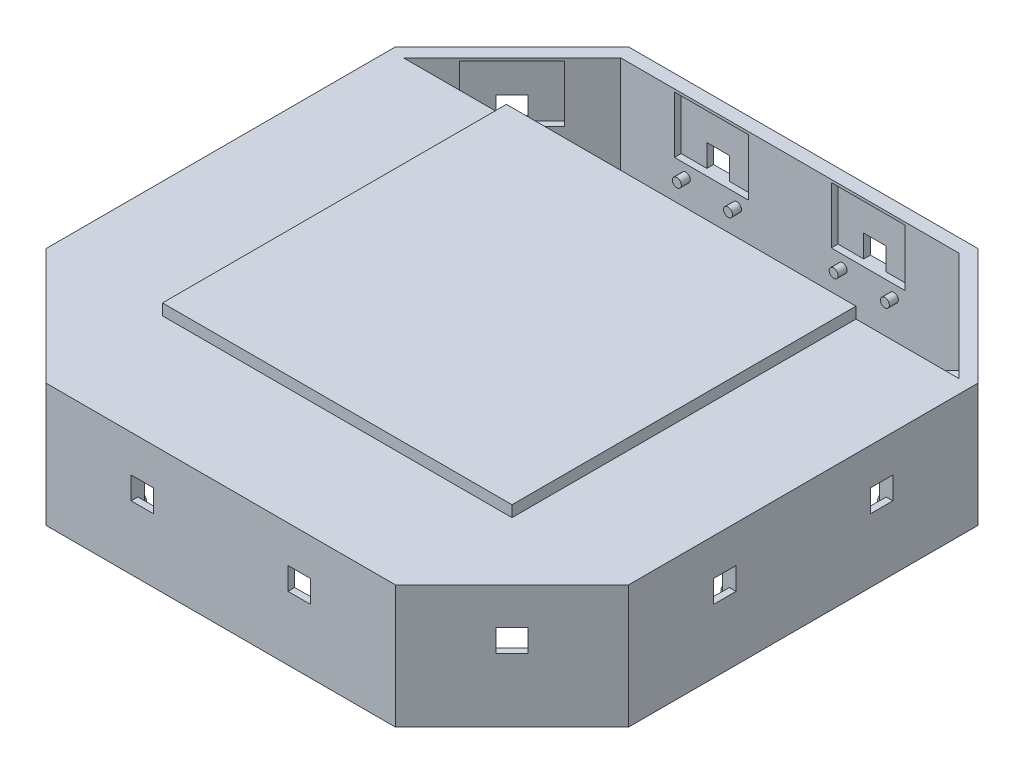
from build123d import *

# Parameters (mm, degrees)
SKETCH1_W            = 78
SKETCH1_H            = 78
BOSS_EXTRUDE1_DEPTH  = 2.5
SKETCH4_W            = 130
SKETCH4_H            = 130
BOSS_EXTRUDE2_DEPTH  = 2.5
CHAMFER1_SIZE        = 26
BOSS_EXTRUDE3_DEPTH  = 25
CUT_EXTRUDE3_REACH   = 147.294
SKETCH6_W            = 5
SKETCH6_H            = 5
CUT_EXTRUDE6_REACH   = 166.774
SKETCH13_W           = 5
SKETCH13_H           = 5
SKETCH9_W            = 12.65
SKETCH9_H            = 16.5
CUT_EXTRUDE5_DEPTH   = 1.5
SKETCH14_W           = 12.65
SKETCH14_H           = 16.5
CUT_EXTRUDE7_DEPTH   = 1.5
SKETCH10_R           = 1
SKETCH10_W           = 2
SKETCH10_H           = 16.5
BOSS_EXTRUDE5_DEPTH  = 2
SKETCH15_R           = 1
SKETCH15_W           = 2
SKETCH15_H           = 16.5
BOSS_EXTRUDE9_DEPTH  = 2
CUT_EXTRUDE8_REACH   = 147.294
SKETCH16_W           = 5
SKETCH16_H           = 5
SKETCH17_W           = 12.65
SKETCH17_H           = 16.5
CUT_EXTRUDE9_DEPTH   = 1.5
SKETCH18_R           = 1
SKETCH18_W           = 2
SKETCH18_H           = 16.5
BOSS_EXTRUDE10_DEPTH = 2
CUT_EXTRUDE10_REACH  = 166.774
SKETCH19_W           = 5
SKETCH19_H           = 5
SKETCH20_W           = 12.65
SKETCH20_H           = 16.5
CUT_EXTRUDE11_DEPTH  = 1.5
SKETCH21_R           = 1
SKETCH21_W           = 2
SKETCH21_H           = 16.5
BOSS_EXTRUDE11_DEPTH = 2
CUT_EXTRUDE12_REACH  = 147.294
SKETCH22_W           = 5
SKETCH22_H           = 5
SKETCH23_W           = 12.65
SKETCH23_H           = 16.5
CUT_EXTRUDE13_DEPTH  = 1.5
BOSS_EXTRUDE12_START = 2
SKETCH24_R           = 1
SKETCH24_W           = 2
SKETCH24_H           = 16.5
BOSS_EXTRUDE12_DEPTH = 2
CUT_EXTRUDE16_REACH  = 97.263
CUT_EXTRUDE17_REACH  = 166.774
SKETCH28_W           = 5
SKETCH28_H           = 5
SKETCH29_W           = 16.5
SKETCH29_H           = 12.65
CUT_EXTRUDE18_DEPTH  = 1.5
SKETCH30_R           = 1
BOSS_EXTRUDE13_DEPTH = 2
CUT_EXTRUDE20_REACH  = 147.294
SKETCH32_W           = 5
SKETCH32_H           = 5
SKETCH33_W           = 16.5
SKETCH33_H           = 12.65
CUT_EXTRUDE21_DEPTH  = 1.5
SKETCH34_R           = 1
BOSS_EXTRUDE14_DEPTH = 2
CUT_EXTRUDE22_REACH  = 166.774
SKETCH35_W           = 5
SKETCH35_H           = 5
SKETCH36_W           = 16.5
SKETCH36_H           = 12.65
CUT_EXTRUDE23_DEPTH  = 1.5
SKETCH37_R           = 1
BOSS_EXTRUDE15_DEPTH = 2


with BuildPart() as part:
    # Sketch1 → Boss-Extrude1 (new body)
    with BuildSketch(Plane(origin=(0, 0, 0), x_dir=(1, 0, 0), z_dir=(0, 1, 0))):
        Rectangle(SKETCH1_W, SKETCH1_H)
    extrude(amount=BOSS_EXTRUDE1_DEPTH)

    # Sketch4 → Boss-Extrude2 (add)
    with BuildSketch(Plane(origin=(0, 0, 0), x_dir=(-1, 0, 0), z_dir=(0, -1, 0))):
        Rectangle(SKETCH4_W, SKETCH4_H)
    extrude(amount=BOSS_EXTRUDE2_DEPTH)

    # Chamfer1
    chamfer1_edges = [part.edges().sort_by_distance(p)[0] for p in [
        (65, -1.25, 65),
        (-65, -1.25, 65),
        (-65, -1.25, -65),
        (65, -1.25, -65),
    ]]
    chamfer(chamfer1_edges, length=CHAMFER1_SIZE)

    # Sketch5 → Boss-Extrude3 (add)
    with BuildSketch(Plane(origin=(0, -2.5, 0), x_dir=(-1, 0, 0), z_dir=(0, -1, 0))):
        Polygon((39, 65), (-39, 65), (-65, 39), (-65, -39), (-39, -65), (39, -65), (65, -39), (65, 39), align=None)
        Polygon((37.757359313, 62), (-37.757359313, 62), (-62, 37.757359313), (-62, -37.757359313), (-37.757359313, -62), (37.757359313, -62), (62, -37.757359313), (62, 37.757359313), align=None, mode=Mode.SUBTRACT)
    extrude(amount=BOSS_EXTRUDE3_DEPTH)

    # Sketch6 → Cut-Extrude3 (cut, up to next)
    with BuildSketch(Plane(origin=(0, 0, 62), x_dir=(-1, 0, 0), z_dir=(0, 0, -1)), mode=Mode.PRIVATE) as cut_extrude3_sk1:
        with Locations((-17.5, -10.75)):
            Rectangle(SKETCH6_W, SKETCH6_H)
    cut_extrude3_tool1 = extrude(cut_extrude3_sk1.sketch, amount=-CUT_EXTRUDE3_REACH, mode=Mode.PRIVATE) & part.part
    # Sketch6 → Cut-Extrude3 (cut, up to next)
    with BuildSketch(Plane(origin=(0, 0, 62), x_dir=(-1, 0, 0), z_dir=(0, 0, -1)), mode=Mode.PRIVATE) as cut_extrude3_sk2:
        with Locations((17.5, -10.75)):
            Rectangle(SKETCH6_W, SKETCH6_H)
    cut_extrude3_tool2 = extrude(cut_extrude3_sk2.sketch, amount=-CUT_EXTRUDE3_REACH, mode=Mode.PRIVATE) & part.part
    add(cut_extrude3_tool1.solids().sort_by_distance((17.5, -10.75, 62))[0], mode=Mode.SUBTRACT)
    add(cut_extrude3_tool2.solids().sort_by_distance((-17.5, -10.75, 62))[0], mode=Mode.SUBTRACT)

    # Sketch13 → Cut-Extrude6 (cut, up to next)
    with BuildSketch(Plane(origin=(-49.878679656, 0, 49.878679656), x_dir=(-0.7071067811865495, 0, -0.7071067811865457), z_dir=(0.7071067811865457, 0, -0.7071067811865495)), mode=Mode.PRIVATE) as cut_extrude6_sk1:
        with Locations((0, -10.75)):
            Rectangle(SKETCH13_W, SKETCH13_H)
    cut_extrude6_tool1 = extrude(cut_extrude6_sk1.sketch, amount=-CUT_EXTRUDE6_REACH, mode=Mode.PRIVATE) & part.part
    add(cut_extrude6_tool1.solids().sort_by_distance((-49.87868, -10.75, 49.87868))[0], mode=Mode.SUBTRACT)

    # Sketch9 → Cut-Extrude5 (cut)
    with BuildSketch(Plane(origin=(0, 0, 62), x_dir=(-1, 0, 0), z_dir=(0, 0, -1))):
        with Locations((13.675, -10.75)):
            Rectangle(SKETCH9_W, SKETCH9_H)
        with Locations((-13.675, -10.75)):
            Rectangle(SKETCH9_W, SKETCH9_H)
    extrude(amount=-CUT_EXTRUDE5_DEPTH, mode=Mode.SUBTRACT)

    # Sketch14 → Cut-Extrude7 (cut)
    with BuildSketch(Plane(origin=(-49.878679656, 0, 49.878679656), x_dir=(-0.7071067811865495, 0, -0.7071067811865457), z_dir=(0.7071067811865457, 0, -0.7071067811865495))):
        with Locations((-3.825, -10.75)):
            Rectangle(SKETCH14_W, SKETCH14_H)
    extrude(amount=-CUT_EXTRUDE7_DEPTH, mode=Mode.SUBTRACT)

    # Sketch10 → Boss-Extrude5 (add)
    with BuildSketch(Plane(origin=(0, 0, 62), x_dir=(-1, 0, 0), z_dir=(0, 0, -1))):
        with Locations((22.59, -16.469)):
            Circle(SKETCH10_R)
        with Locations((22.59, -5.039)):
            Circle(SKETCH10_R)
        with Locations((-22.59, -16.469)):
            Circle(SKETCH10_R)
        with Locations((-22.59, -5.039)):
            Circle(SKETCH10_R)
        with Locations((6.35, -10.75)):
            Rectangle(SKETCH10_W, SKETCH10_H)
        with Locations((-6.35, -10.75)):
            Rectangle(SKETCH10_W, SKETCH10_H)
    extrude(amount=BOSS_EXTRUDE5_DEPTH)

    # Sketch15 → Boss-Extrude9 (add)
    with BuildSketch(Plane(origin=(-49.878679656, 0, 49.878679656), x_dir=(-0.7071067811865495, 0, -0.7071067811865457), z_dir=(0.7071067811865457, 0, -0.7071067811865495))):
        with Locations((5.09, -16.465)):
            Circle(SKETCH15_R)
        with Locations((5.09, -5.035)):
            Circle(SKETCH15_R)
        with Locations((-11.15, -10.75)):
            Rectangle(SKETCH15_W, SKETCH15_H)
    extrude(amount=BOSS_EXTRUDE9_DEPTH)

    # Sketch16 → Cut-Extrude8 (cut, up to next)
    with BuildSketch(Plane(origin=(-62, 0, 0), x_dir=(0, 0, -1), z_dir=(1, 0, 0)), mode=Mode.PRIVATE) as cut_extrude8_sk1:
        with Locations((17.5, -10.75)):
            Rectangle(SKETCH16_W, SKETCH16_H)
    cut_extrude8_tool1 = extrude(cut_extrude8_sk1.sketch, amount=-CUT_EXTRUDE8_REACH, mode=Mode.PRIVATE) & part.part
    # Sketch16 → Cut-Extrude8 (cut, up to next)
    with BuildSketch(Plane(origin=(-62, 0, 0), x_dir=(0, 0, -1), z_dir=(1, 0, 0)), mode=Mode.PRIVATE) as cut_extrude8_sk2:
        with Locations((-17.5, -10.75)):
            Rectangle(SKETCH16_W, SKETCH16_H)
    cut_extrude8_tool2 = extrude(cut_extrude8_sk2.sketch, amount=-CUT_EXTRUDE8_REACH, mode=Mode.PRIVATE) & part.part
    add(cut_extrude8_tool1.solids().sort_by_distance((-62, -10.75, -17.5))[0], mode=Mode.SUBTRACT)
    add(cut_extrude8_tool2.solids().sort_by_distance((-62, -10.75, 17.5))[0], mode=Mode.SUBTRACT)

    # Sketch17 → Cut-Extrude9 (cut)
    with BuildSketch(Plane(origin=(-62, 0, 0), x_dir=(0, 0, -1), z_dir=(1, 0, 0))):
        with Locations((-21.325, -10.75)):
            Rectangle(SKETCH17_W, SKETCH17_H)
        with Locations((13.675, -10.75)):
            Rectangle(SKETCH17_W, SKETCH17_H)
    extrude(amount=-CUT_EXTRUDE9_DEPTH, mode=Mode.SUBTRACT)

    # Sketch18 → Boss-Extrude10 (add)
    with BuildSketch(Plane(origin=(-62, 0, 0), x_dir=(0, 0, -1), z_dir=(1, 0, 0))):
        with Locations((22.59, -16.465)):
            Circle(SKETCH18_R)
        with Locations((22.59, -5.035)):
            Circle(SKETCH18_R)
        with Locations((-12.41, -16.465)):
            Circle(SKETCH18_R)
        with Locations((-12.41, -5.035)):
            Circle(SKETCH18_R)
        with Locations((6.35, -10.75)):
            Rectangle(SKETCH18_W, SKETCH18_H)
        with Locations((-28.65, -10.75)):
            Rectangle(SKETCH18_W, SKETCH18_H)
    extrude(amount=BOSS_EXTRUDE10_DEPTH)

    # Sketch19 → Cut-Extrude10 (cut, up to next)
    with BuildSketch(Plane(origin=(49.878679656, 0, 49.878679656), x_dir=(-0.707106781186546, 0, 0.707106781186549), z_dir=(-0.707106781186549, 0, -0.707106781186546)), mode=Mode.PRIVATE) as cut_extrude10_sk1:
        with Locations((0, -10.75)):
            Rectangle(SKETCH19_W, SKETCH19_H)
    cut_extrude10_tool1 = extrude(cut_extrude10_sk1.sketch, amount=-CUT_EXTRUDE10_REACH, mode=Mode.PRIVATE) & part.part
    add(cut_extrude10_tool1.solids().sort_by_distance((49.87868, -10.75, 49.87868))[0], mode=Mode.SUBTRACT)

    # Sketch20 → Cut-Extrude11 (cut)
    with BuildSketch(Plane(origin=(49.878679656, 0, 49.878679656), x_dir=(-0.707106781186546, 0, 0.707106781186549), z_dir=(-0.707106781186549, 0, -0.707106781186546))):
        with Locations((3.825, -10.75)):
            Rectangle(SKETCH20_W, SKETCH20_H)
    extrude(amount=-CUT_EXTRUDE11_DEPTH, mode=Mode.SUBTRACT)

    # Sketch21 → Boss-Extrude11 (add)
    with BuildSketch(Plane(origin=(49.878679656, 0, 49.878679656), x_dir=(-0.707106781186546, 0, 0.707106781186549), z_dir=(-0.707106781186549, 0, -0.707106781186546))):
        with Locations((-5.09, -16.465)):
            Circle(SKETCH21_R)
        with Locations((-5.09, -5.035)):
            Circle(SKETCH21_R)
        with Locations((11.15, -10.75)):
            Rectangle(SKETCH21_W, SKETCH21_H)
    extrude(amount=BOSS_EXTRUDE11_DEPTH)

    # Sketch22 → Cut-Extrude12 (cut, up to next)
    with BuildSketch(Plane.ZY.offset(-62), mode=Mode.PRIVATE) as cut_extrude12_sk1:
        with Locations((17.5, -10.75)):
            Rectangle(SKETCH22_W, SKETCH22_H)
    cut_extrude12_tool1 = extrude(cut_extrude12_sk1.sketch, amount=-CUT_EXTRUDE12_REACH, mode=Mode.PRIVATE) & part.part
    # Sketch22 → Cut-Extrude12 (cut, up to next)
    with BuildSketch(Plane.ZY.offset(-62), mode=Mode.PRIVATE) as cut_extrude12_sk2:
        with Locations((-17.5, -10.75)):
            Rectangle(SKETCH22_W, SKETCH22_H)
    cut_extrude12_tool2 = extrude(cut_extrude12_sk2.sketch, amount=-CUT_EXTRUDE12_REACH, mode=Mode.PRIVATE) & part.part
    add(cut_extrude12_tool1.solids().sort_by_distance((62, -10.75, 17.5))[0], mode=Mode.SUBTRACT)
    add(cut_extrude12_tool2.solids().sort_by_distance((62, -10.75, -17.5))[0], mode=Mode.SUBTRACT)

    # Sketch23 → Cut-Extrude13 (cut)
    with BuildSketch(Plane.ZY.offset(-62)):
        with Locations((21.325, -10.75)):
            Rectangle(SKETCH23_W, SKETCH23_H)
        with Locations((-13.675, -10.75)):
            Rectangle(SKETCH23_W, SKETCH23_H)
    extrude(amount=-CUT_EXTRUDE13_DEPTH, mode=Mode.SUBTRACT)

    # Sketch24 → Boss-Extrude12 (add)
    with BuildSketch(Plane.ZY.offset(-62).offset(BOSS_EXTRUDE12_START)):
        with Locations((12.41, -16.465)):
            Circle(SKETCH24_R)
        with Locations((12.41, -5.035)):
            Circle(SKETCH24_R)
        with Locations((-22.59, -16.465)):
            Circle(SKETCH24_R)
        with Locations((-22.59, -5.035)):
            Circle(SKETCH24_R)
        with Locations((28.65, -10.75)):
            Rectangle(SKETCH24_W, SKETCH24_H)
        with Locations((-6.35, -10.75)):
            Rectangle(SKETCH24_W, SKETCH24_H)
    extrude(amount=-BOSS_EXTRUDE12_DEPTH)

    # Sketch27 → Cut-Extrude16 (cut, up to next)
    with BuildSketch(Plane(origin=(0, -2.5, 0), x_dir=(-1, 0, 0), z_dir=(0, -1, 0)), mode=Mode.PRIVATE) as cut_extrude16_sk1:
        Polygon((-62, 37.757359313), (-37.757359313, 62), (37.757359313, 62), (62, 37.757359313), align=None)
    cut_extrude16_tool1 = extrude(cut_extrude16_sk1.sketch, amount=-CUT_EXTRUDE16_REACH, mode=Mode.PRIVATE) & part.part
    add(cut_extrude16_tool1.solids().sort_by_distance((0, -2.5, -48.896788))[0], mode=Mode.SUBTRACT)

    # Sketch28 → Cut-Extrude17 (cut, up to next)
    with BuildSketch(Plane(origin=(49.878679656, 0, -49.878679656), x_dir=(0.7071067811865485, 0, 0.7071067811865467), z_dir=(-0.7071067811865467, 0, 0.7071067811865485)), mode=Mode.PRIVATE) as cut_extrude17_sk1:
        with Locations((0, -10.75)):
            Rectangle(SKETCH28_W, SKETCH28_H)
    cut_extrude17_tool1 = extrude(cut_extrude17_sk1.sketch, amount=-CUT_EXTRUDE17_REACH, mode=Mode.PRIVATE) & part.part
    add(cut_extrude17_tool1.solids().sort_by_distance((49.87868, -10.75, -49.87868))[0], mode=Mode.SUBTRACT)

    # Sketch29 → Cut-Extrude18 (cut)
    with BuildSketch(Plane(origin=(49.878679656, 0, -49.878679656), x_dir=(0.7071067811865485, 0, 0.7071067811865467), z_dir=(-0.7071067811865467, 0, 0.7071067811865485))):
        with Locations((0, -6.925)):
            Rectangle(SKETCH29_W, SKETCH29_H)
    extrude(amount=-CUT_EXTRUDE18_DEPTH, mode=Mode.SUBTRACT)

    # Sketch30 → Boss-Extrude13 (add)
    with BuildSketch(Plane(origin=(49.878679656, 0, -49.878679656), x_dir=(0.7071067811865485, 0, 0.7071067811865467), z_dir=(-0.7071067811865467, 0, 0.7071067811865485))):
        with Locations((5.715, -15.84)):
            Circle(SKETCH30_R)
        with Locations((-5.715, -15.84)):
            Circle(SKETCH30_R)
    extrude(amount=BOSS_EXTRUDE13_DEPTH)

    # Sketch32 → Cut-Extrude20 (cut, up to next)
    with BuildSketch(Plane.XY.offset(-62), mode=Mode.PRIVATE) as cut_extrude20_sk1:
        with Locations((17.5, -10.75)):
            Rectangle(SKETCH32_W, SKETCH32_H)
    cut_extrude20_tool1 = extrude(cut_extrude20_sk1.sketch, amount=-CUT_EXTRUDE20_REACH, mode=Mode.PRIVATE) & part.part
    # Sketch32 → Cut-Extrude20 (cut, up to next)
    with BuildSketch(Plane.XY.offset(-62), mode=Mode.PRIVATE) as cut_extrude20_sk2:
        with Locations((-17.5, -10.75)):
            Rectangle(SKETCH32_W, SKETCH32_H)
    cut_extrude20_tool2 = extrude(cut_extrude20_sk2.sketch, amount=-CUT_EXTRUDE20_REACH, mode=Mode.PRIVATE) & part.part
    add(cut_extrude20_tool1.solids().sort_by_distance((17.5, -10.75, -62))[0], mode=Mode.SUBTRACT)
    add(cut_extrude20_tool2.solids().sort_by_distance((-17.5, -10.75, -62))[0], mode=Mode.SUBTRACT)

    # Sketch33 → Cut-Extrude21 (cut)
    with BuildSketch(Plane.XY.offset(-62)):
        with Locations((17.5, -6.925)):
            Rectangle(SKETCH33_W, SKETCH33_H)
        with Locations((-17.5, -6.925)):
            Rectangle(SKETCH33_W, SKETCH33_H)
    extrude(amount=-CUT_EXTRUDE21_DEPTH, mode=Mode.SUBTRACT)

    # Sketch34 → Boss-Extrude14 (add)
    with BuildSketch(Plane.XY.offset(-62)):
        with Locations((23.215, -15.84)):
            Circle(SKETCH34_R)
        with Locations((11.785, -15.84)):
            Circle(SKETCH34_R)
        with Locations((-11.785, -15.84)):
            Circle(SKETCH34_R)
        with Locations((-23.215, -15.84)):
            Circle(SKETCH34_R)
    extrude(amount=BOSS_EXTRUDE14_DEPTH)

    # Sketch35 → Cut-Extrude22 (cut, up to next)
    with BuildSketch(Plane(origin=(-49.878679656, 0, -49.878679656), x_dir=(0.7071067811865465, 0, -0.7071067811865487), z_dir=(0.7071067811865487, 0, 0.7071067811865465)), mode=Mode.PRIVATE) as cut_extrude22_sk1:
        with Locations((0, -10.75)):
            Rectangle(SKETCH35_W, SKETCH35_H)
    cut_extrude22_tool1 = extrude(cut_extrude22_sk1.sketch, amount=-CUT_EXTRUDE22_REACH, mode=Mode.PRIVATE) & part.part
    add(cut_extrude22_tool1.solids().sort_by_distance((-49.87868, -10.75, -49.87868))[0], mode=Mode.SUBTRACT)

    # Sketch36 → Cut-Extrude23 (cut)
    with BuildSketch(Plane(origin=(-49.878679656, 0, -49.878679656), x_dir=(0.7071067811865465, 0, -0.7071067811865487), z_dir=(0.7071067811865487, 0, 0.7071067811865465))):
        with Locations((0, -6.925)):
            Rectangle(SKETCH36_W, SKETCH36_H)
    extrude(amount=-CUT_EXTRUDE23_DEPTH, mode=Mode.SUBTRACT)

    # Sketch37 → Boss-Extrude15 (add)
    with BuildSketch(Plane(origin=(-49.878679656, 0, -49.878679656), x_dir=(0.7071067811865465, 0, -0.7071067811865487), z_dir=(0.7071067811865487, 0, 0.7071067811865465))):
        with Locations((5.715, -15.84)):
            Circle(SKETCH37_R)
        with Locations((-5.715, -15.84)):
            Circle(SKETCH37_R)
    extrude(amount=BOSS_EXTRUDE15_DEPTH)


solid = part.part
